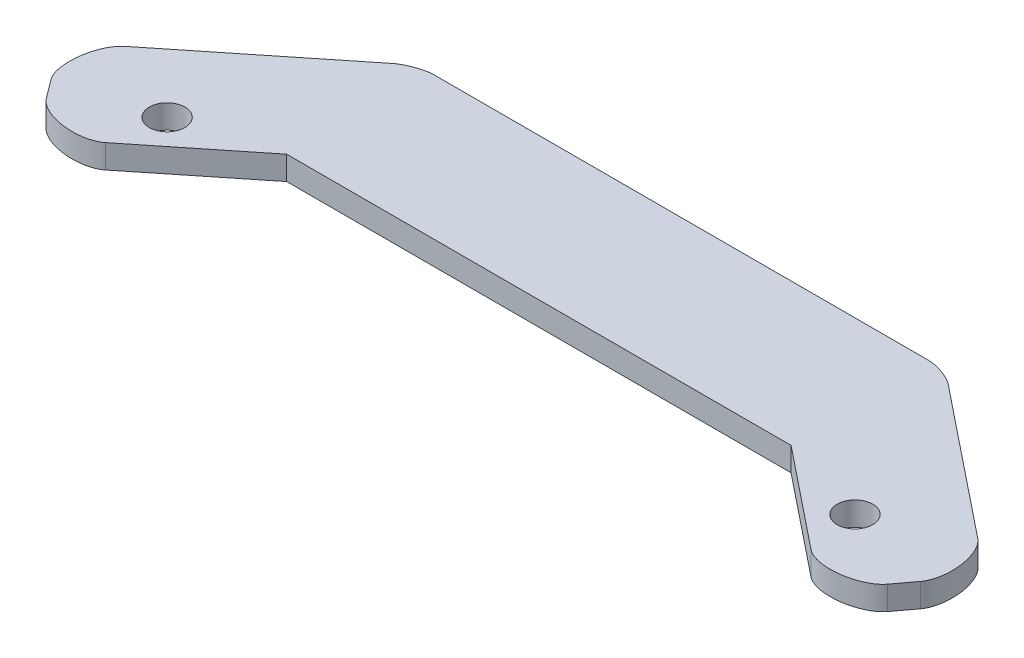
from build123d import *

# Parameters (mm, degrees)
SKETCH3_R           = 1.190625
BOSS_EXTRUDE1_DEPTH = 1.5875


with BuildPart() as part:
    # Sketch3 → Boss-Extrude1 (new body)
    with BuildSketch(Plane(origin=(0, 0, 0), x_dir=(1, 0, 0), z_dir=(0, 1, 0))):
        Polygon((-22.929311402, 25.613223092), (-13.634997975, 33.054629342), (20.099377025, 33.054629342), (29.393690453, 25.613223092), (34.156190453, 31.968309197), (24.861877025, 39.409715447), (20.902655838, 42.579629342), (-14.438276788, 42.579629342), (-18.397497975, 39.409715447), (-27.691811402, 31.968309197), align=None)
        with Locations(Location((-19.770435938, 31.192788903, 0), (0, 0, 270))):
            Circle(SKETCH3_R, mode=Mode.SUBTRACT)
        with Locations(Location((26.234814989, 31.192788903, 0), (0, 0, 270))):
            Circle(SKETCH3_R, mode=Mode.SUBTRACT)
    extrude(amount=BOSS_EXTRUDE1_DEPTH)

    # Fillet1
    # a fillet whose section is not a circle: 3.175 mm, written as the material it takes off along each edge
    with BuildSketch(Plane(origin=(-22.929311402, -8.195772914, -25.613223092), x_dir=(0.7806247497998012, 0, -0.6249999999999982), z_dir=(0, 1, 0)), Plane(origin=(29.393690453, -8.195772914, -25.613223092), x_dir=(0.5996925441644039, 0, -0.8002304995897274), z_dir=(0, 1, 0))) as fillet1_piece_1:
        with BuildLine():
            Bezier((3.278309166, 0), (0, 0), (0.104936119, 3.276629273), weights=[1, 0.448951306, 1])
            Line((0.104936119, 3.276629273), (0, 0))
            Line((0, 0), (3.278309166, 0))
        make_face()
    extrude(amount=17.979045828, mode=Mode.SUBTRACT)
    with BuildSketch(Plane(origin=(-27.691811402, -7.687366025, -31.968309197), x_dir=(0.7806247497998011, 0, -0.6249999999999983), z_dir=(0, 1, 0))) as fillet1_piece_2:
        with BuildLine():
            Bezier((3.07494641, 0), (0, 0), (-0.098426636, -3.073370727), weights=[1, 0.463559427, 1])
            Line((-0.098426636, -3.073370727), (0, 0))
            Line((0, 0), (3.07494641, 0))
        make_face()
    extrude(amount=16.962232051, mode=Mode.SUBTRACT)
    with BuildSketch(Plane(origin=(34.156190453, -7.687366025, -31.968309197), x_dir=(-0.7806247497995835, 0, -0.62500000000027), z_dir=(0, 1, 0))) as fillet1_piece_3:
        with BuildLine():
            Bezier((3.07494641, 0), (0, 0), (-0.098426636, 3.073370727), weights=[1, 0.463559427, 1])
            Line((-0.098426636, 3.073370727), (0, 0))
            Line((0, 0), (3.07494641, 0))
        make_face()
    extrude(amount=16.962232051, mode=Mode.SUBTRACT)
    with BuildSketch(Plane(origin=(20.902655838, -2.786065678, -42.579629342), x_dir=(-1, 0, 0), z_dir=(0, 1, 0)), Plane(origin=(-14.438276788, -2.786065678, -42.579629342), x_dir=(-0.780624749799802, 0, 0.6249999999999972), z_dir=(0, 1, 0))) as fillet1_piece_4:
        with BuildLine():
            Bezier((1.114426271, 0), (0, 0), (-0.869948729, 0.696516419), weights=[1, 0.608905409, 1])
            Line((-0.869948729, 0.696516419), (0, 0))
            Line((0, 0), (1.114426271, 0))
        make_face()
    extrude(amount=7.159631355, mode=Mode.SUBTRACT)


solid = part.part
